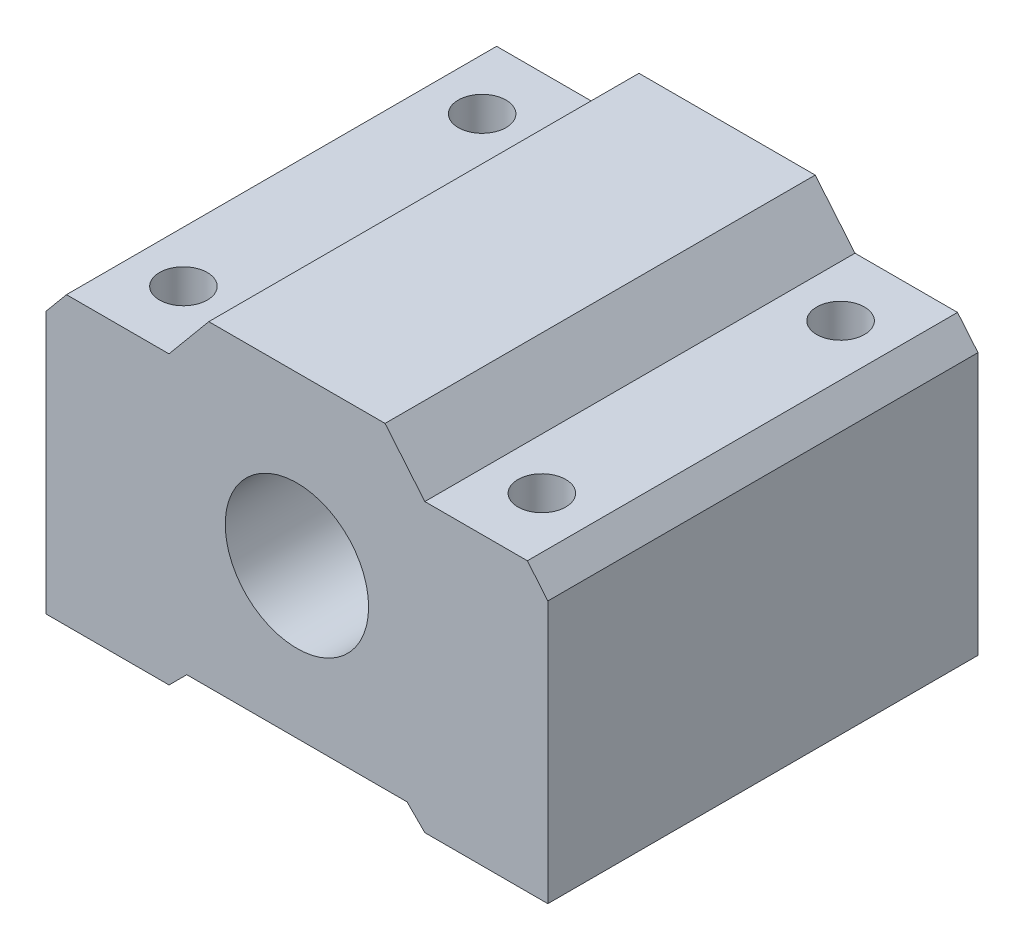
from build123d import *

# Parameters (mm, degrees)
SKETCH1_R           = 6
BOSS_EXTRUDE1_DEPTH = 36
CUT_EXTRUDE1_REACH  = 52.21
SKETCH2_R           = 2


with BuildPart() as part:
    # Sketch1 → Boss-Extrude1 (new body)
    with BuildSketch(Plane.XY):
        Polygon((-7.376347734, 14), (-10.704853009, 10), (-19.287228785, 10), (-21, 7.941693254), (-21, -14), (-12.193167268, -14), (-10.704853009, -14), (-9.216538749, -12.511685741), (9.216538749, -12.511685741), (10.704853009, -14), (12.193167268, -14), (21, -14), (21, 7.941693254), (19.287228785, 10), (10.704853009, 10), (7.376347734, 14), align=None)
        Circle(SKETCH1_R, mode=Mode.SUBTRACT)
    extrude(amount=BOSS_EXTRUDE1_DEPTH)

    # Sketch2 → Cut-Extrude1 (cut, up to next)
    with BuildSketch(Plane.XZ.offset(14), mode=Mode.PRIVATE) as cut_extrude1_sk1:
        with Locations((-15, 30.5)):
            Circle(SKETCH2_R)
    cut_extrude1_tool1 = extrude(cut_extrude1_sk1.sketch, amount=-CUT_EXTRUDE1_REACH, mode=Mode.PRIVATE) & part.part
    # Sketch2 → Cut-Extrude1 (cut, up to next)
    with BuildSketch(Plane.XZ.offset(14), mode=Mode.PRIVATE) as cut_extrude1_sk2:
        with Locations((15, 30.5)):
            Circle(SKETCH2_R)
    cut_extrude1_tool2 = extrude(cut_extrude1_sk2.sketch, amount=-CUT_EXTRUDE1_REACH, mode=Mode.PRIVATE) & part.part
    # Sketch2 → Cut-Extrude1 (cut, up to next)
    with BuildSketch(Plane.XZ.offset(14), mode=Mode.PRIVATE) as cut_extrude1_sk3:
        with Locations((15, 5.5)):
            Circle(SKETCH2_R)
    cut_extrude1_tool3 = extrude(cut_extrude1_sk3.sketch, amount=-CUT_EXTRUDE1_REACH, mode=Mode.PRIVATE) & part.part
    # Sketch2 → Cut-Extrude1 (cut, up to next)
    with BuildSketch(Plane.XZ.offset(14), mode=Mode.PRIVATE) as cut_extrude1_sk4:
        with Locations((-15, 5.5)):
            Circle(SKETCH2_R)
    cut_extrude1_tool4 = extrude(cut_extrude1_sk4.sketch, amount=-CUT_EXTRUDE1_REACH, mode=Mode.PRIVATE) & part.part
    add(cut_extrude1_tool1.solids().sort_by_distance((-15, -14, 30.5))[0], mode=Mode.SUBTRACT)
    add(cut_extrude1_tool2.solids().sort_by_distance((15, -14, 30.5))[0], mode=Mode.SUBTRACT)
    add(cut_extrude1_tool3.solids().sort_by_distance((15, -14, 5.5))[0], mode=Mode.SUBTRACT)
    add(cut_extrude1_tool4.solids().sort_by_distance((-15, -14, 5.5))[0], mode=Mode.SUBTRACT)


solid = part.part
